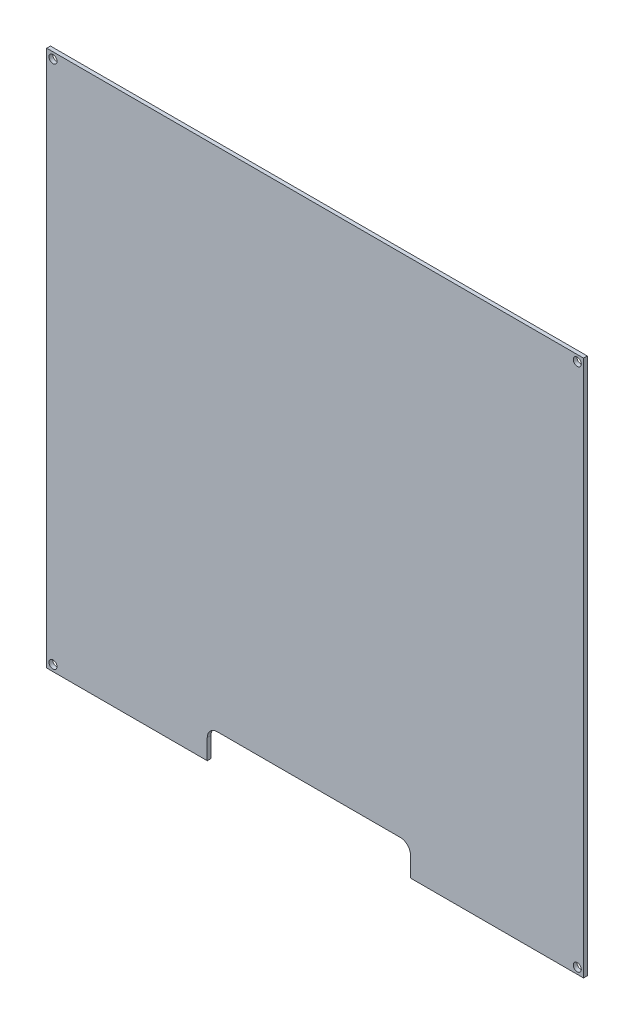
from build123d import *

# Parameters (mm, degrees)
SKETCH1_W           = 214
SKETCH1_H           = 214
SKETCH1_R           = 1.6
BOSS_EXTRUDE1_DEPTH = 1.5
SKETCH2_W           = 81
SKETCH2_H           = 12
CUT_EXTRUDE1_DEPTH  = 152.328285525
FILLET1_R           = 4


with BuildPart() as part:
    # Sketch1 → Boss-Extrude1 (new body)
    with BuildSketch(Plane.XY):
        Rectangle(SKETCH1_W, SKETCH1_H)
        with Locations((-104.5, 104.5)):
            Circle(SKETCH1_R, mode=Mode.SUBTRACT)
        with Locations((104.5, 104.5)):
            Circle(SKETCH1_R, mode=Mode.SUBTRACT)
        with Locations((0, -104.5)):
            Circle(SKETCH1_R, mode=Mode.SUBTRACT)
        with Locations((104.5, -104.5)):
            Circle(SKETCH1_R, mode=Mode.SUBTRACT)
        with Locations((-104.5, -104.5)):
            Circle(SKETCH1_R, mode=Mode.SUBTRACT)
    extrude(amount=BOSS_EXTRUDE1_DEPTH)

    # Sketch2 → Cut-Extrude1 (cut, through all)
    with BuildSketch(Plane.XY.offset(1.5)):
        with Locations((-2.5, -101)):
            Rectangle(SKETCH2_W, SKETCH2_H)
    extrude(amount=-CUT_EXTRUDE1_DEPTH, mode=Mode.SUBTRACT)

    # Fillet1
    fillet1_edges = [part.edges().sort_by_distance(p)[0] for p in [
        (38, -95, 0.75),
        (-43, -95, 0.75),
    ]]
    fillet(fillet1_edges, radius=FILLET1_R)


solid = part.part
